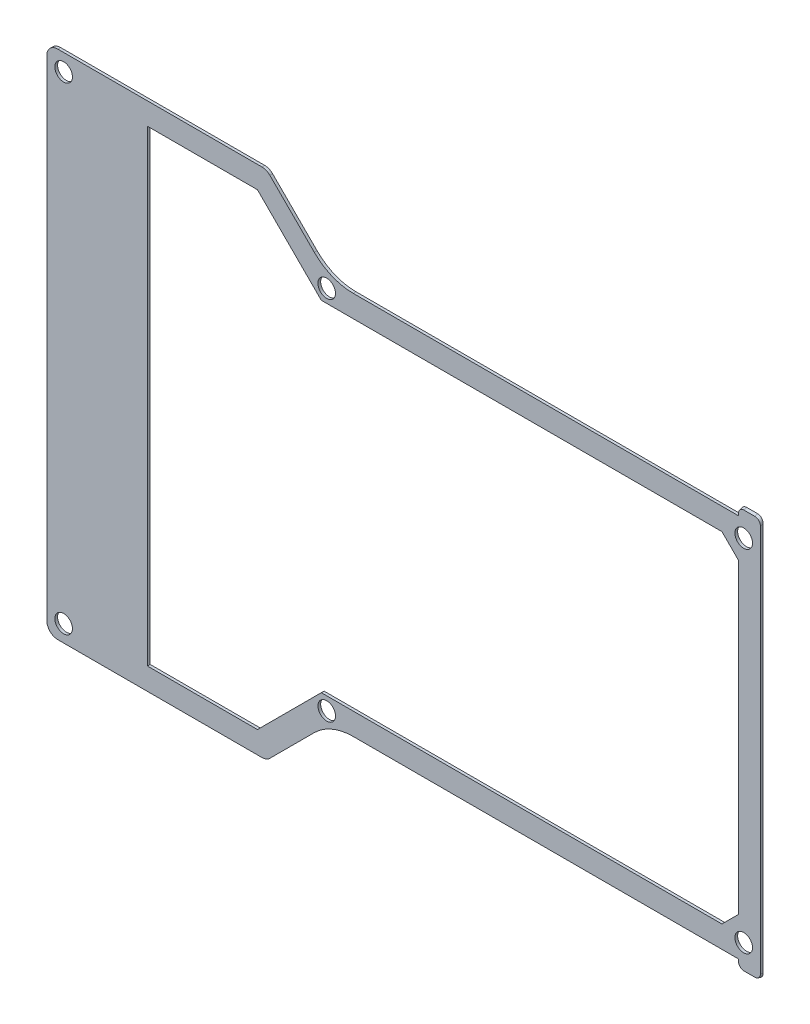
from build123d import *

# Parameters (mm, degrees)
SKETCH1_R           = 1.6
BOSS_EXTRUDE1_DEPTH = 0.5
CUT_EXTRUDE3_DEPTH  = 10
FILLET1_R           = 1


with BuildPart() as part:
    # Sketch1 → Boss-Extrude1 (new body)
    with BuildSketch(Plane.XY):
        with BuildLine():
            ThreePointArc((37.403989873, -22.874599188), (33.57715555, -22.113394513), (30.332922061, -19.945667))
            Line((30.332922061, -19.945667), (22.242640687, -11.855385626))
            ThreePointArc((22.242640687, -11.855385626), (21.593793989, -11.421840123), (20.828427125, -11.269599188))
            Line((20.828427125, -11.269599188), (-16.3, -11.269599188))
            ThreePointArc((-16.3, -11.269599188), (-17.714213562, -11.855385626), (-18.3, -13.269599188))
            Line((-18.3, -13.269599188), (-18.3, -102.269599188))
            ThreePointArc((-18.3, -102.269599188), (-17.714213562, -103.68381275), (-16.3, -104.269599188))
            Line((-16.3, -104.269599188), (20.828427125, -104.269599188))
            ThreePointArc((20.828427125, -104.269599188), (21.593793989, -104.117358253), (22.242640687, -103.68381275))
            Line((22.242640687, -103.68381275), (30.337922061, -95.588531376))
            ThreePointArc((30.337922061, -95.588531376), (33.58215555, -93.420803863), (37.408989873, -92.659599188))
            Line((37.408989873, -92.659599188), (107.455, -92.659599188))
            Line((107.455, -92.659599188), (107.455, -94.229460967))
            Line((107.455, -94.229460967), (111.455, -94.229460967))
            Line((111.455, -94.229460967), (111.455, -21.305413491))
            Line((111.455, -21.305413491), (110.455, -21.305413491))
            Line((110.455, -21.305413491), (108.455, -21.305413491))
            Line((108.455, -21.305413491), (107.455, -21.305413491))
            Line((107.455, -21.305413491), (107.455, -22.874599188))
            Line((107.455, -22.874599188), (37.403989873, -22.874599188))
        make_face()
        with Locations((-15.239339828, -101.208939016)):
            Circle(SKETCH1_R, mode=Mode.SUBTRACT)
        with Locations((32.596077775, -91.040201526)):
            Circle(SKETCH1_R, mode=Mode.SUBTRACT)
        with Locations((108.412106781, -89.616705969)):
            Circle(SKETCH1_R, mode=Mode.SUBTRACT)
        with Locations((-15.239339828, -14.33025936)):
            Circle(SKETCH1_R, mode=Mode.SUBTRACT)
        with Locations((32.591077775, -24.493996851)):
            Circle(SKETCH1_R, mode=Mode.SUBTRACT)
        Polygon((31.61, -88.659599188), (20, -100.269599188), (0, -100.269599188), (0, -15.269599188), (20, -15.269599188), (31.605, -26.874599188), (104.455, -26.874599188), (107.455, -29.874599188), (107.455, -85.659599188), (104.455, -88.659599188), align=None, mode=Mode.SUBTRACT)
        with Locations((108.412106781, -25.917492407)):
            Circle(SKETCH1_R, mode=Mode.SUBTRACT)
    extrude(amount=BOSS_EXTRUDE1_DEPTH)

    # Sketch2 → Cut-Extrude3 (cut)
    with BuildSketch(Plane(origin=(111.455, 0, 0), x_dir=(0, 0, -1), z_dir=(1, 0, 0))):
        Polygon((-2.509224917, -22.180400125), (0, -21.305413491), (1.866342624, -18.933308689), (-2.23434161, -18.933308689), align=None)
        Polygon((4.266625508, -98.662833417), (0, -94.229460967), (-3.714378177, -92.933669782), (-3.714378177, -98.662833417), align=None)
    extrude(amount=-CUT_EXTRUDE3_DEPTH, mode=Mode.SUBTRACT)

    # Fillet1
    fillet1_edges = [part.edges().sort_by_distance(p)[0] for p in [
        (107.455, -94.142246424, 0.25),
        (111.455, -94.142246424, 0.25),
        (107.455, -21.392590474, 0.25),
        (111.455, -21.392590474, 0.25),
    ]]
    fillet(fillet1_edges, radius=FILLET1_R)


solid = part.part
